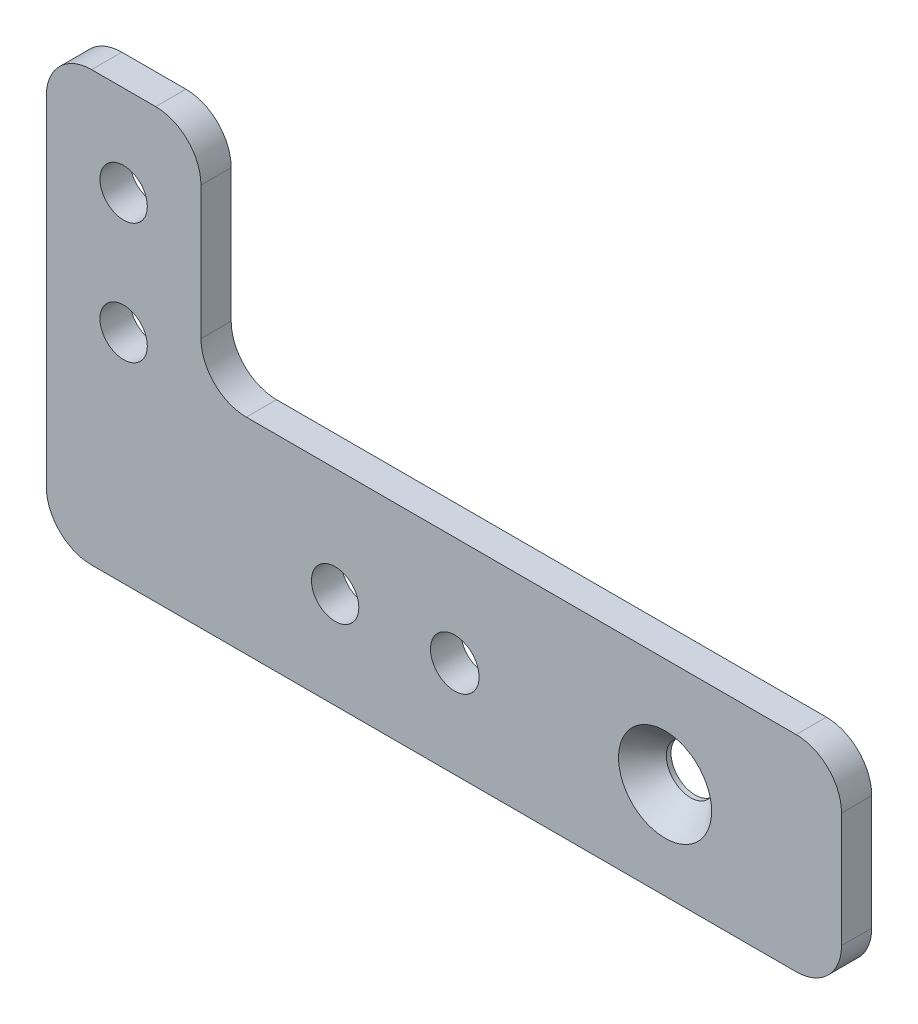
from build123d import *

# Parameters (mm, degrees)
SKETCH1_R                                       = 2.4892
SKETCH1_R_2                                     = 2.5527
BOSS_EXTRUDE1_DEPTH                             = 3.175
FILLET1_R                                       = 4.7625
CSK_FOR_10_FLAT_HEAD_MACHINE_SCREW1_D           = 5.1054
CSK_FOR_10_FLAT_HEAD_MACHINE_SCREW1_DEPTH       = 19.05
CSK_FOR_10_FLAT_HEAD_MACHINE_SCREW1_CSINK_D     = 9.779
CSK_FOR_10_FLAT_HEAD_MACHINE_SCREW1_CSINK_ANGLE = 82
CSK_FOR_10_FLAT_HEAD_MACHINE_SCREW1_TIP         = 1.533816902


with BuildPart() as part:
    # Sketch1 → Boss-Extrude1 (new body)
    with BuildSketch(Plane.XY):
        Polygon((-37.846, 23.8125), (-37.846, -21.2725), (45.72, -21.2725), (45.72, 0.3175), (-21.59, 0.3175), (-21.59, 23.8125), align=None)
        with Locations((-7.493, -11.1125)):
            Circle(SKETCH1_R, mode=Mode.SUBTRACT)
        with Locations((5.08, -11.1125)):
            Circle(SKETCH1_R_2, mode=Mode.SUBTRACT)
        with Locations((27.178, -11.1125)):
            Circle(SKETCH1_R_2, mode=Mode.SUBTRACT)
        with Locations((-29.718, 1.5875)):
            Circle(SKETCH1_R, mode=Mode.SUBTRACT)
        with Locations((-29.718, 14.2875)):
            Circle(SKETCH1_R, mode=Mode.SUBTRACT)
    extrude(amount=BOSS_EXTRUDE1_DEPTH)

    # Fillet1
    fillet1_edges = [part.edges().sort_by_distance(p)[0] for p in [
        (-37.846, 23.8125, 1.5875),
        (-21.59, 23.8125, 1.5875),
        (-21.59, 0.3175, 1.5875),
        (45.72, 0.3175, 1.5875),
        (45.72, -21.2725, 1.5875),
        (-37.846, -21.2725, 1.5875),
    ]]
    fillet(fillet1_edges, radius=FILLET1_R)

    # CSK for #10 Flat Head Machine Screw1
    with Locations(Plane.XY.offset(3.175)):
        with Locations((27.178, -11.1125)):
            CounterSinkHole(CSK_FOR_10_FLAT_HEAD_MACHINE_SCREW1_D / 2, CSK_FOR_10_FLAT_HEAD_MACHINE_SCREW1_CSINK_D / 2, depth=CSK_FOR_10_FLAT_HEAD_MACHINE_SCREW1_DEPTH, counter_sink_angle=CSK_FOR_10_FLAT_HEAD_MACHINE_SCREW1_CSINK_ANGLE)
            with Locations((0, 0, -(CSK_FOR_10_FLAT_HEAD_MACHINE_SCREW1_DEPTH + CSK_FOR_10_FLAT_HEAD_MACHINE_SCREW1_TIP / 2))):  # 118° drill point
                Cone(0, CSK_FOR_10_FLAT_HEAD_MACHINE_SCREW1_D / 2, CSK_FOR_10_FLAT_HEAD_MACHINE_SCREW1_TIP, mode=Mode.SUBTRACT)


solid = part.part
